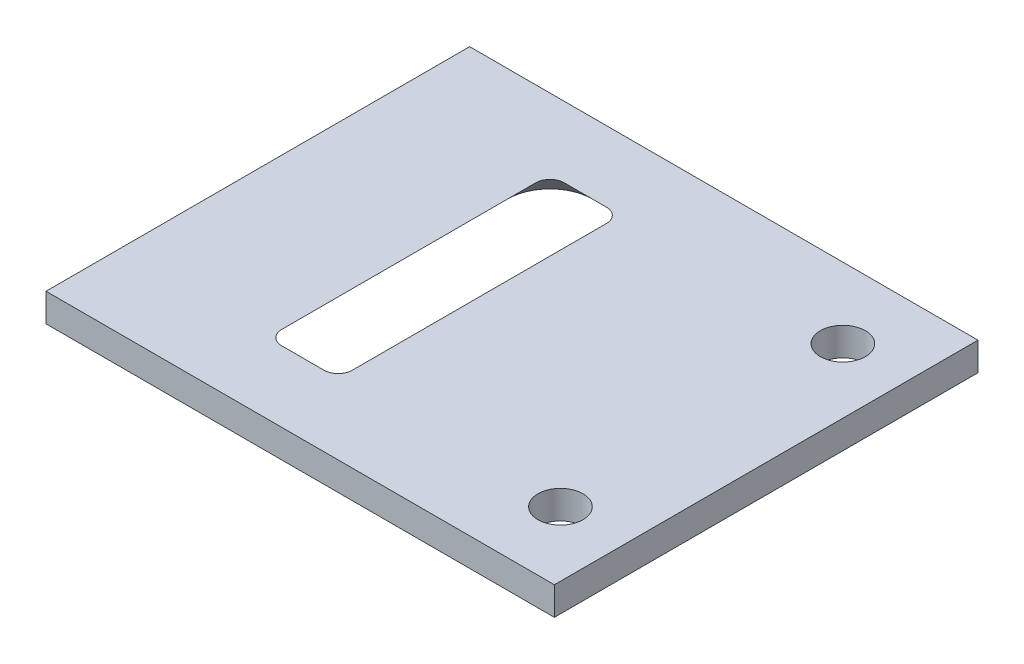
from build123d import *

# Parameters (mm, degrees)
SKETCH2_W           = 36
SKETCH2_H           = 30
BOSS_EXTRUDE1_DEPTH = 2
CUT_EXTRUDE4_DEPTH  = 28.374130722
CUT_EXTRUDE4_DRAFT  = 45
SKETCH5_R           = 1.595
CUT_EXTRUDE5_DEPTH  = 28.374130722


with BuildPart() as part:
    # Sketch2 → Boss-Extrude1 (new body)
    with BuildSketch(Plane(origin=(0, 0, 0), x_dir=(1, 0, 0), z_dir=(0, 1, 0))):
        with Locations((4.811028754, 0)):
            Rectangle(SKETCH2_W, SKETCH2_H)
    extrude(amount=BOSS_EXTRUDE1_DEPTH)


with BuildPart() as cut_extrude4_tool:
    # Sketch4 → Cut-Extrude4 (with draft: the straight prism first)
    with BuildSketch(Plane(origin=(0, 2, 0), x_dir=(1, 0, 0), z_dir=(0, 1, 0))):
        with BuildLine():
            ThreePointArc((1.5, -10), (2.207106781, -9.707106781), (2.5, -9))
            Line((2.5, -9), (2.5, 9))
            ThreePointArc((2.5, 9), (2.207106781, 9.707106781), (1.5, 10))
            Line((1.5, 10), (-1.5, 10))
            ThreePointArc((-1.5, 10), (-2.207106781, 9.707106781), (-2.5, 9))
            Line((-2.5, 9), (-2.5, -9))
            ThreePointArc((-2.5, -9), (-2.207106781, -9.707106781), (-1.5, -10))
            Line((-1.5, -10), (1.5, -10))
        make_face()
    extrude(amount=-CUT_EXTRUDE4_DEPTH)
    # Cut-Extrude4: the draft: its side faces are tilted about the plane it starts from
    cut_extrude4_sides = [cut_extrude4_tool.faces().sort_by_distance(p)[0] for p in [
        (-2.207106781, -12.187065361, 9.707106781),
        (0, -12.187065361, 10),
        (2.207106781, -12.187065361, 9.707106781),
        (2.5, -12.187065361, 0),
        (2.207106781, -12.187065361, -9.707106781),
        (0, -12.187065361, -10),
        (-2.207106781, -12.187065361, -9.707106781),
        (-2.5, -12.187065361, 0),
    ]]
    draft(cut_extrude4_sides, Plane(origin=(0, 2, 0), x_dir=(1, 0, 0), z_dir=(0, 1, 0)), CUT_EXTRUDE4_DRAFT)


with BuildPart() as part_1:
    add(part.part)

    # Cut-Extrude4: cut by cut_extrude4_tool
    add(cut_extrude4_tool.part, mode=Mode.SUBTRACT)

    # Sketch5 → Cut-Extrude5 (cut, through all)
    with BuildSketch(Plane(origin=(0, 2, 0), x_dir=(1, 0, 0), z_dir=(0, 1, 0))):
        with Locations((18.242707696, -10)):
            Circle(SKETCH5_R)
        with Locations((18.242707696, 10)):
            Circle(SKETCH5_R)
    extrude(amount=-CUT_EXTRUDE5_DEPTH, mode=Mode.SUBTRACT)


solid = part_1.part
